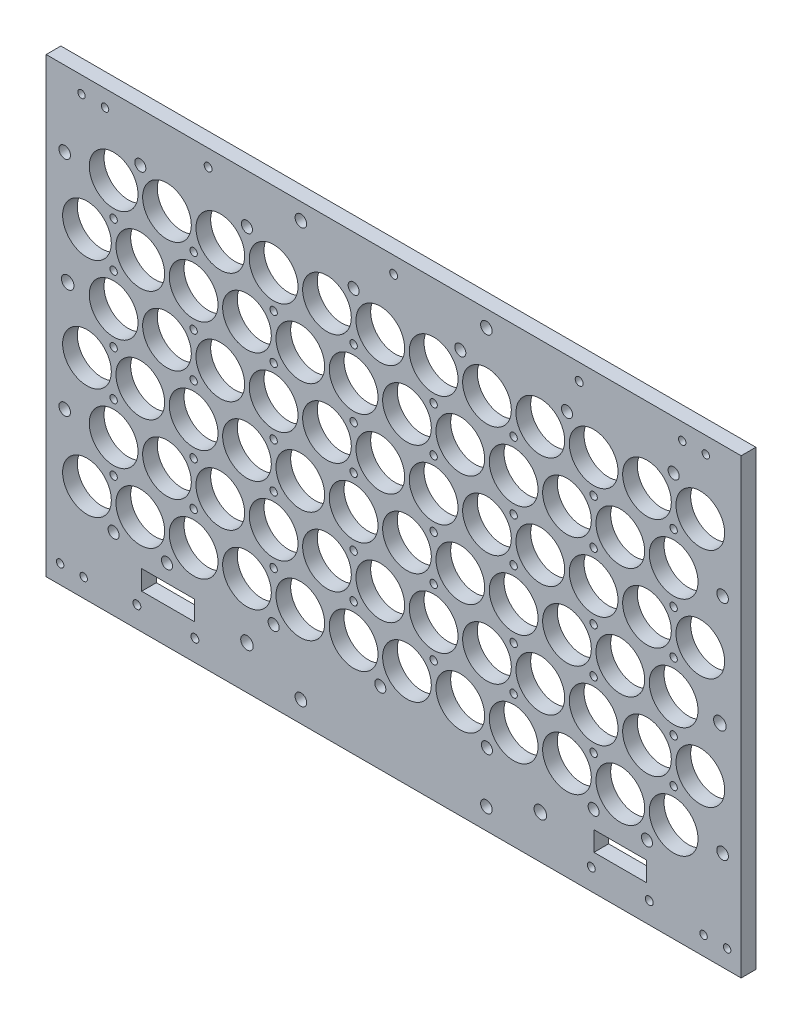
from build123d import *

# Parameters (mm, degrees)
SKETCH1_W                  = 299.700000132
SKETCH1_H                  = 194.250000104
BOSS_EXTRUDE1_DEPTH        = 6.35
SKETCH3_R                  = 10.4988
CUT_EXTRUDE1_DEPTH         = 182.719853184
SKETCH4_R                  = 10.4988
CUT_EXTRUDE2_DEPTH         = 182.719853184
LPATTERN1_COUNT            = 12
LPATTERN1_PITCH            = 23
LPATTERN2_COPY_1_SKETCH_R  = 10.4988
LPATTERN2_COPY_1_DEPTH     = 182.719853184
LPATTERN2_COPY_2_SKETCH_R  = 10.4988
LPATTERN2_COPY_2_DEPTH     = 182.719853184
LPATTERN2_COPY_3_SKETCH_R  = 10.4988
LPATTERN2_COPY_3_DEPTH     = 182.719853184
LPATTERN2_COPY_4_SKETCH_R  = 10.4988
LPATTERN2_COPY_4_DEPTH     = 182.719853184
LPATTERN2_COPY_5_SKETCH_R  = 10.4988
LPATTERN2_COPY_5_DEPTH     = 182.719853184
LPATTERN2_COPY_6_SKETCH_R  = 10.4988
LPATTERN2_COPY_6_DEPTH     = 182.719853184
LPATTERN2_COPY_7_SKETCH_R  = 10.4988
LPATTERN2_COPY_7_DEPTH     = 182.719853184
LPATTERN2_COPY_8_SKETCH_R  = 10.4988
LPATTERN2_COPY_8_DEPTH     = 182.719853184
LPATTERN2_COPY_9_SKETCH_R  = 10.4988
LPATTERN2_COPY_9_DEPTH     = 182.719853184
LPATTERN2_COPY_10_SKETCH_R = 10.4988
LPATTERN2_COPY_10_DEPTH    = 182.719853184
LPATTERN2_COPY_11_SKETCH_R = 10.4988
LPATTERN2_COPY_11_DEPTH    = 182.719853184
LPATTERN2_COPY_12_SKETCH_R = 10.4988
LPATTERN2_COPY_12_DEPTH    = 182.719853184
LPATTERN2_COPY_13_SKETCH_R = 10.4988
LPATTERN2_COPY_13_DEPTH    = 182.719853184
LPATTERN2_COPY_14_SKETCH_R = 10.4988
LPATTERN2_COPY_14_DEPTH    = 182.719853184
LPATTERN2_COPY_15_SKETCH_R = 10.4988
LPATTERN2_COPY_15_DEPTH    = 182.719853184
LPATTERN2_COPY_16_SKETCH_R = 10.4988
LPATTERN2_COPY_16_DEPTH    = 182.719853184
LPATTERN2_COPY_17_SKETCH_R = 10.4988
LPATTERN2_COPY_17_DEPTH    = 182.719853184
LPATTERN2_COPY_18_SKETCH_R = 10.4988
LPATTERN2_COPY_18_DEPTH    = 182.719853184
LPATTERN2_COPY_19_SKETCH_R = 10.4988
LPATTERN2_COPY_19_DEPTH    = 182.719853184
LPATTERN2_COPY_20_SKETCH_R = 10.4988
LPATTERN2_COPY_20_DEPTH    = 182.719853184
LPATTERN2_COPY_21_SKETCH_R = 10.4988
LPATTERN2_COPY_21_DEPTH    = 182.719853184
LPATTERN2_COPY_22_SKETCH_R = 10.4988
LPATTERN2_COPY_22_DEPTH    = 182.719853184
LPATTERN2_COPY_23_SKETCH_R = 10.4988
LPATTERN2_COPY_23_DEPTH    = 182.719853184
LPATTERN2_COPY_24_SKETCH_R = 10.4988
LPATTERN2_COPY_24_DEPTH    = 182.719853184
LPATTERN2_COPY_25_SKETCH_R = 10.4988
LPATTERN2_COPY_25_DEPTH    = 182.719853184
LPATTERN2_COPY_26_SKETCH_R = 10.4988
LPATTERN2_COPY_26_DEPTH    = 182.719853184
LPATTERN2_COPY_27_SKETCH_R = 10.4988
LPATTERN2_COPY_27_DEPTH    = 182.719853184
LPATTERN2_COPY_28_SKETCH_R = 10.4988
LPATTERN2_COPY_28_DEPTH    = 182.719853184
LPATTERN2_COPY_29_SKETCH_R = 10.4988
LPATTERN2_COPY_29_DEPTH    = 182.719853184
LPATTERN2_COPY_30_SKETCH_R = 10.4988
LPATTERN2_COPY_30_DEPTH    = 182.719853184
LPATTERN2_COPY_31_SKETCH_R = 10.4988
LPATTERN2_COPY_31_DEPTH    = 182.719853184
LPATTERN2_COPY_32_SKETCH_R = 10.4988
LPATTERN2_COPY_32_DEPTH    = 182.719853184
LPATTERN2_COPY_33_SKETCH_R = 10.4988
LPATTERN2_COPY_33_DEPTH    = 182.719853184
LPATTERN2_COPY_34_SKETCH_R = 10.4988
LPATTERN2_COPY_34_DEPTH    = 182.719853184
LPATTERN2_COPY_35_SKETCH_R = 10.4988
LPATTERN2_COPY_35_DEPTH    = 182.719853184
LPATTERN2_COPY_36_SKETCH_R = 10.4988
LPATTERN2_COPY_36_DEPTH    = 182.719853184
LPATTERN2_COPY_37_SKETCH_R = 10.4988
LPATTERN2_COPY_37_DEPTH    = 182.719853184
LPATTERN2_COPY_38_SKETCH_R = 10.4988
LPATTERN2_COPY_38_DEPTH    = 182.719853184
LPATTERN2_COPY_39_SKETCH_R = 10.4988
LPATTERN2_COPY_39_DEPTH    = 182.719853184
LPATTERN2_COPY_40_SKETCH_R = 10.4988
LPATTERN2_COPY_40_DEPTH    = 182.719853184
LPATTERN2_COPY_41_SKETCH_R = 10.4988
LPATTERN2_COPY_41_DEPTH    = 182.719853184
LPATTERN2_COPY_42_SKETCH_R = 10.4988
LPATTERN2_COPY_42_DEPTH    = 182.719853184
LPATTERN2_COPY_43_SKETCH_R = 10.4988
LPATTERN2_COPY_43_DEPTH    = 182.719853184
LPATTERN2_COPY_44_SKETCH_R = 10.4988
LPATTERN2_COPY_44_DEPTH    = 182.719853184
LPATTERN2_COPY_45_SKETCH_R = 10.4988
LPATTERN2_COPY_45_DEPTH    = 182.719853184
LPATTERN2_COPY_46_SKETCH_R = 10.4988
LPATTERN2_COPY_46_DEPTH    = 182.719853184
LPATTERN2_COPY_47_SKETCH_R = 10.4988
LPATTERN2_COPY_47_DEPTH    = 182.719853184
LPATTERN2_COPY_48_SKETCH_R = 10.4988
LPATTERN2_COPY_48_DEPTH    = 182.719853184
SKETCH5_W                  = 22.76
SKETCH5_H                  = 8.4615
CUT_EXTRUDE3_DEPTH         = 182.719853184
M3_CLEARANCE_HOLE1_D       = 3.2
M3_CLEARANCE_HOLE2_D       = 3.4
SKETCH14_R                 = 2.7
CUT_EXTRUDE4_DEPTH         = 182.719853184
SKETCH15_R                 = 2.5
CUT_EXTRUDE5_DEPTH         = 182.719853184
SKETCH18_R                 = 2.38125
CUT_EXTRUDE7_DEPTH         = 182.719853184
SKETCH19_W                 = 299.700000132
SKETCH19_H                 = 6.35
BOSS_EXTRUDE2_DEPTH        = 0.79375
SKETCH22_R                 = 1.5875
CUT_EXTRUDE8_DEPTH         = 182.719853184
LPATTERN3_COUNT            = 3
LPATTERN3_PITCH            = 48
SKETCH23_R                 = 1.5875
CUT_EXTRUDE9_DEPTH         = 182.719853184
LPATTERN4_COUNT            = 2
LPATTERN4_PITCH            = 48
LPATTERN5_COUNT            = 4
LPATTERN5_PITCH            = 69
LPATTERN5_COPY_1_SKETCH_R  = 1.5875
LPATTERN5_COPY_1_DEPTH     = 182.719853184
LPATTERN5_COPY_2_SKETCH_R  = 1.5875
LPATTERN5_COPY_2_DEPTH     = 182.719853184
LPATTERN5_COPY_3_SKETCH_R  = 1.5875
LPATTERN5_COPY_3_DEPTH     = 182.719853184
LPATTERN5_COPY_4_SKETCH_R  = 1.5875
LPATTERN5_COPY_4_DEPTH     = 182.719853184
LPATTERN5_COPY_5_SKETCH_R  = 1.5875
LPATTERN5_COPY_5_DEPTH     = 182.719853184
LPATTERN5_COPY_6_SKETCH_R  = 1.5875
LPATTERN5_COPY_6_DEPTH     = 182.719853184
LPATTERN5_COPY_7_SKETCH_R  = 1.5875
LPATTERN5_COPY_7_DEPTH     = 182.719853184
LPATTERN5_COPY_8_SKETCH_R  = 1.5875
LPATTERN5_COPY_8_DEPTH     = 182.719853184
LPATTERN5_COPY_9_SKETCH_R  = 1.5875
LPATTERN5_COPY_9_DEPTH     = 182.719853184
M3_CLEARANCE_HOLE3_D       = 3.4


with BuildPart() as part:
    # Sketch1 → Boss-Extrude1 (new body)
    with BuildSketch(Plane.XY):
        with Locations((0, -5.475000052)):
            Rectangle(SKETCH1_W, SKETCH1_H)
    extrude(amount=BOSS_EXTRUDE1_DEPTH)

    # Sketch3 → Cut-Extrude1 (cut, through all)
    with BuildSketch(Plane.XY.offset(6.35)):
        with Locations((-132.25, -60)):
            Circle(SKETCH3_R)
    cut_extrude1 = extrude(amount=-CUT_EXTRUDE1_DEPTH, mode=Mode.SUBTRACT)

    # Sketch4 → Cut-Extrude2 (cut, through all)
    with BuildSketch(Plane.XY.offset(6.35)):
        with Locations((-120.75, -36)):
            Circle(SKETCH4_R)
    cut_extrude2 = extrude(amount=-CUT_EXTRUDE2_DEPTH, mode=Mode.SUBTRACT)

    # LPattern1: Cut-Extrude1, Cut-Extrude2 ×12
    with Locations(*[(i * LPATTERN1_PITCH, 0, 0) for i in range(1, LPATTERN1_COUNT)]):
        add(cut_extrude1, mode=Mode.SUBTRACT)
        add(cut_extrude2, mode=Mode.SUBTRACT)

    # LPattern2 copy 1 sketch → LPattern2 copy 1 (cut, through all)
    with BuildSketch(Plane(origin=(23, 48, 6.35), x_dir=(1, 0, 0), z_dir=(0, 0, 1))):
        with Locations((-132.25, -60)):
            Circle(LPATTERN2_COPY_1_SKETCH_R)
    extrude(amount=-LPATTERN2_COPY_1_DEPTH, mode=Mode.SUBTRACT)

    # LPattern2 copy 2 sketch → LPattern2 copy 2 (cut, through all)
    with BuildSketch(Plane(origin=(23, 96, 6.35), x_dir=(1, 0, 0), z_dir=(0, 0, 1))):
        with Locations((-132.25, -60)):
            Circle(LPATTERN2_COPY_2_SKETCH_R)
    extrude(amount=-LPATTERN2_COPY_2_DEPTH, mode=Mode.SUBTRACT)

    # LPattern2 copy 3 sketch → LPattern2 copy 3 (cut, through all)
    with BuildSketch(Plane(origin=(46, 48, 6.35), x_dir=(1, 0, 0), z_dir=(0, 0, 1))):
        with Locations((-132.25, -60)):
            Circle(LPATTERN2_COPY_3_SKETCH_R)
    extrude(amount=-LPATTERN2_COPY_3_DEPTH, mode=Mode.SUBTRACT)

    # LPattern2 copy 4 sketch → LPattern2 copy 4 (cut, through all)
    with BuildSketch(Plane(origin=(46, 96, 6.35), x_dir=(1, 0, 0), z_dir=(0, 0, 1))):
        with Locations((-132.25, -60)):
            Circle(LPATTERN2_COPY_4_SKETCH_R)
    extrude(amount=-LPATTERN2_COPY_4_DEPTH, mode=Mode.SUBTRACT)

    # LPattern2 copy 5 sketch → LPattern2 copy 5 (cut, through all)
    with BuildSketch(Plane(origin=(69, 48, 6.35), x_dir=(1, 0, 0), z_dir=(0, 0, 1))):
        with Locations((-132.25, -60)):
            Circle(LPATTERN2_COPY_5_SKETCH_R)
    extrude(amount=-LPATTERN2_COPY_5_DEPTH, mode=Mode.SUBTRACT)

    # LPattern2 copy 6 sketch → LPattern2 copy 6 (cut, through all)
    with BuildSketch(Plane(origin=(69, 96, 6.35), x_dir=(1, 0, 0), z_dir=(0, 0, 1))):
        with Locations((-132.25, -60)):
            Circle(LPATTERN2_COPY_6_SKETCH_R)
    extrude(amount=-LPATTERN2_COPY_6_DEPTH, mode=Mode.SUBTRACT)

    # LPattern2 copy 7 sketch → LPattern2 copy 7 (cut, through all)
    with BuildSketch(Plane(origin=(92, 48, 6.35), x_dir=(1, 0, 0), z_dir=(0, 0, 1))):
        with Locations((-132.25, -60)):
            Circle(LPATTERN2_COPY_7_SKETCH_R)
    extrude(amount=-LPATTERN2_COPY_7_DEPTH, mode=Mode.SUBTRACT)

    # LPattern2 copy 8 sketch → LPattern2 copy 8 (cut, through all)
    with BuildSketch(Plane(origin=(92, 96, 6.35), x_dir=(1, 0, 0), z_dir=(0, 0, 1))):
        with Locations((-132.25, -60)):
            Circle(LPATTERN2_COPY_8_SKETCH_R)
    extrude(amount=-LPATTERN2_COPY_8_DEPTH, mode=Mode.SUBTRACT)

    # LPattern2 copy 9 sketch → LPattern2 copy 9 (cut, through all)
    with BuildSketch(Plane(origin=(115, 48, 6.35), x_dir=(1, 0, 0), z_dir=(0, 0, 1))):
        with Locations((-132.25, -60)):
            Circle(LPATTERN2_COPY_9_SKETCH_R)
    extrude(amount=-LPATTERN2_COPY_9_DEPTH, mode=Mode.SUBTRACT)

    # LPattern2 copy 10 sketch → LPattern2 copy 10 (cut, through all)
    with BuildSketch(Plane(origin=(115, 96, 6.35), x_dir=(1, 0, 0), z_dir=(0, 0, 1))):
        with Locations((-132.25, -60)):
            Circle(LPATTERN2_COPY_10_SKETCH_R)
    extrude(amount=-LPATTERN2_COPY_10_DEPTH, mode=Mode.SUBTRACT)

    # LPattern2 copy 11 sketch → LPattern2 copy 11 (cut, through all)
    with BuildSketch(Plane(origin=(138, 48, 6.35), x_dir=(1, 0, 0), z_dir=(0, 0, 1))):
        with Locations((-132.25, -60)):
            Circle(LPATTERN2_COPY_11_SKETCH_R)
    extrude(amount=-LPATTERN2_COPY_11_DEPTH, mode=Mode.SUBTRACT)

    # LPattern2 copy 12 sketch → LPattern2 copy 12 (cut, through all)
    with BuildSketch(Plane(origin=(138, 96, 6.35), x_dir=(1, 0, 0), z_dir=(0, 0, 1))):
        with Locations((-132.25, -60)):
            Circle(LPATTERN2_COPY_12_SKETCH_R)
    extrude(amount=-LPATTERN2_COPY_12_DEPTH, mode=Mode.SUBTRACT)

    # LPattern2 copy 13 sketch → LPattern2 copy 13 (cut, through all)
    with BuildSketch(Plane(origin=(161, 48, 6.35), x_dir=(1, 0, 0), z_dir=(0, 0, 1))):
        with Locations((-132.25, -60)):
            Circle(LPATTERN2_COPY_13_SKETCH_R)
    extrude(amount=-LPATTERN2_COPY_13_DEPTH, mode=Mode.SUBTRACT)

    # LPattern2 copy 14 sketch → LPattern2 copy 14 (cut, through all)
    with BuildSketch(Plane(origin=(161, 96, 6.35), x_dir=(1, 0, 0), z_dir=(0, 0, 1))):
        with Locations((-132.25, -60)):
            Circle(LPATTERN2_COPY_14_SKETCH_R)
    extrude(amount=-LPATTERN2_COPY_14_DEPTH, mode=Mode.SUBTRACT)

    # LPattern2 copy 15 sketch → LPattern2 copy 15 (cut, through all)
    with BuildSketch(Plane(origin=(184, 48, 6.35), x_dir=(1, 0, 0), z_dir=(0, 0, 1))):
        with Locations((-132.25, -60)):
            Circle(LPATTERN2_COPY_15_SKETCH_R)
    extrude(amount=-LPATTERN2_COPY_15_DEPTH, mode=Mode.SUBTRACT)

    # LPattern2 copy 16 sketch → LPattern2 copy 16 (cut, through all)
    with BuildSketch(Plane(origin=(184, 96, 6.35), x_dir=(1, 0, 0), z_dir=(0, 0, 1))):
        with Locations((-132.25, -60)):
            Circle(LPATTERN2_COPY_16_SKETCH_R)
    extrude(amount=-LPATTERN2_COPY_16_DEPTH, mode=Mode.SUBTRACT)

    # LPattern2 copy 17 sketch → LPattern2 copy 17 (cut, through all)
    with BuildSketch(Plane(origin=(207, 48, 6.35), x_dir=(1, 0, 0), z_dir=(0, 0, 1))):
        with Locations((-132.25, -60)):
            Circle(LPATTERN2_COPY_17_SKETCH_R)
    extrude(amount=-LPATTERN2_COPY_17_DEPTH, mode=Mode.SUBTRACT)

    # LPattern2 copy 18 sketch → LPattern2 copy 18 (cut, through all)
    with BuildSketch(Plane(origin=(207, 96, 6.35), x_dir=(1, 0, 0), z_dir=(0, 0, 1))):
        with Locations((-132.25, -60)):
            Circle(LPATTERN2_COPY_18_SKETCH_R)
    extrude(amount=-LPATTERN2_COPY_18_DEPTH, mode=Mode.SUBTRACT)

    # LPattern2 copy 19 sketch → LPattern2 copy 19 (cut, through all)
    with BuildSketch(Plane(origin=(230, 48, 6.35), x_dir=(1, 0, 0), z_dir=(0, 0, 1))):
        with Locations((-132.25, -60)):
            Circle(LPATTERN2_COPY_19_SKETCH_R)
    extrude(amount=-LPATTERN2_COPY_19_DEPTH, mode=Mode.SUBTRACT)

    # LPattern2 copy 20 sketch → LPattern2 copy 20 (cut, through all)
    with BuildSketch(Plane(origin=(230, 96, 6.35), x_dir=(1, 0, 0), z_dir=(0, 0, 1))):
        with Locations((-132.25, -60)):
            Circle(LPATTERN2_COPY_20_SKETCH_R)
    extrude(amount=-LPATTERN2_COPY_20_DEPTH, mode=Mode.SUBTRACT)

    # LPattern2 copy 21 sketch → LPattern2 copy 21 (cut, through all)
    with BuildSketch(Plane(origin=(253, 48, 6.35), x_dir=(1, 0, 0), z_dir=(0, 0, 1))):
        with Locations((-132.25, -60)):
            Circle(LPATTERN2_COPY_21_SKETCH_R)
    extrude(amount=-LPATTERN2_COPY_21_DEPTH, mode=Mode.SUBTRACT)

    # LPattern2 copy 22 sketch → LPattern2 copy 22 (cut, through all)
    with BuildSketch(Plane(origin=(253, 96, 6.35), x_dir=(1, 0, 0), z_dir=(0, 0, 1))):
        with Locations((-132.25, -60)):
            Circle(LPATTERN2_COPY_22_SKETCH_R)
    extrude(amount=-LPATTERN2_COPY_22_DEPTH, mode=Mode.SUBTRACT)

    # LPattern2 copy 23 sketch → LPattern2 copy 23 (cut, through all)
    with BuildSketch(Plane(origin=(23, 48, 6.35), x_dir=(1, 0, 0), z_dir=(0, 0, 1))):
        with Locations((-120.75, -36)):
            Circle(LPATTERN2_COPY_23_SKETCH_R)
    extrude(amount=-LPATTERN2_COPY_23_DEPTH, mode=Mode.SUBTRACT)

    # LPattern2 copy 24 sketch → LPattern2 copy 24 (cut, through all)
    with BuildSketch(Plane(origin=(23, 96, 6.35), x_dir=(1, 0, 0), z_dir=(0, 0, 1))):
        with Locations((-120.75, -36)):
            Circle(LPATTERN2_COPY_24_SKETCH_R)
    extrude(amount=-LPATTERN2_COPY_24_DEPTH, mode=Mode.SUBTRACT)

    # LPattern2 copy 25 sketch → LPattern2 copy 25 (cut, through all)
    with BuildSketch(Plane(origin=(46, 48, 6.35), x_dir=(1, 0, 0), z_dir=(0, 0, 1))):
        with Locations((-120.75, -36)):
            Circle(LPATTERN2_COPY_25_SKETCH_R)
    extrude(amount=-LPATTERN2_COPY_25_DEPTH, mode=Mode.SUBTRACT)

    # LPattern2 copy 26 sketch → LPattern2 copy 26 (cut, through all)
    with BuildSketch(Plane(origin=(46, 96, 6.35), x_dir=(1, 0, 0), z_dir=(0, 0, 1))):
        with Locations((-120.75, -36)):
            Circle(LPATTERN2_COPY_26_SKETCH_R)
    extrude(amount=-LPATTERN2_COPY_26_DEPTH, mode=Mode.SUBTRACT)

    # LPattern2 copy 27 sketch → LPattern2 copy 27 (cut, through all)
    with BuildSketch(Plane(origin=(69, 48, 6.35), x_dir=(1, 0, 0), z_dir=(0, 0, 1))):
        with Locations((-120.75, -36)):
            Circle(LPATTERN2_COPY_27_SKETCH_R)
    extrude(amount=-LPATTERN2_COPY_27_DEPTH, mode=Mode.SUBTRACT)

    # LPattern2 copy 28 sketch → LPattern2 copy 28 (cut, through all)
    with BuildSketch(Plane(origin=(69, 96, 6.35), x_dir=(1, 0, 0), z_dir=(0, 0, 1))):
        with Locations((-120.75, -36)):
            Circle(LPATTERN2_COPY_28_SKETCH_R)
    extrude(amount=-LPATTERN2_COPY_28_DEPTH, mode=Mode.SUBTRACT)

    # LPattern2 copy 29 sketch → LPattern2 copy 29 (cut, through all)
    with BuildSketch(Plane(origin=(92, 48, 6.35), x_dir=(1, 0, 0), z_dir=(0, 0, 1))):
        with Locations((-120.75, -36)):
            Circle(LPATTERN2_COPY_29_SKETCH_R)
    extrude(amount=-LPATTERN2_COPY_29_DEPTH, mode=Mode.SUBTRACT)

    # LPattern2 copy 30 sketch → LPattern2 copy 30 (cut, through all)
    with BuildSketch(Plane(origin=(92, 96, 6.35), x_dir=(1, 0, 0), z_dir=(0, 0, 1))):
        with Locations((-120.75, -36)):
            Circle(LPATTERN2_COPY_30_SKETCH_R)
    extrude(amount=-LPATTERN2_COPY_30_DEPTH, mode=Mode.SUBTRACT)

    # LPattern2 copy 31 sketch → LPattern2 copy 31 (cut, through all)
    with BuildSketch(Plane(origin=(115, 48, 6.35), x_dir=(1, 0, 0), z_dir=(0, 0, 1))):
        with Locations((-120.75, -36)):
            Circle(LPATTERN2_COPY_31_SKETCH_R)
    extrude(amount=-LPATTERN2_COPY_31_DEPTH, mode=Mode.SUBTRACT)

    # LPattern2 copy 32 sketch → LPattern2 copy 32 (cut, through all)
    with BuildSketch(Plane(origin=(115, 96, 6.35), x_dir=(1, 0, 0), z_dir=(0, 0, 1))):
        with Locations((-120.75, -36)):
            Circle(LPATTERN2_COPY_32_SKETCH_R)
    extrude(amount=-LPATTERN2_COPY_32_DEPTH, mode=Mode.SUBTRACT)

    # LPattern2 copy 33 sketch → LPattern2 copy 33 (cut, through all)
    with BuildSketch(Plane(origin=(138, 48, 6.35), x_dir=(1, 0, 0), z_dir=(0, 0, 1))):
        with Locations((-120.75, -36)):
            Circle(LPATTERN2_COPY_33_SKETCH_R)
    extrude(amount=-LPATTERN2_COPY_33_DEPTH, mode=Mode.SUBTRACT)

    # LPattern2 copy 34 sketch → LPattern2 copy 34 (cut, through all)
    with BuildSketch(Plane(origin=(138, 96, 6.35), x_dir=(1, 0, 0), z_dir=(0, 0, 1))):
        with Locations((-120.75, -36)):
            Circle(LPATTERN2_COPY_34_SKETCH_R)
    extrude(amount=-LPATTERN2_COPY_34_DEPTH, mode=Mode.SUBTRACT)

    # LPattern2 copy 35 sketch → LPattern2 copy 35 (cut, through all)
    with BuildSketch(Plane(origin=(161, 48, 6.35), x_dir=(1, 0, 0), z_dir=(0, 0, 1))):
        with Locations((-120.75, -36)):
            Circle(LPATTERN2_COPY_35_SKETCH_R)
    extrude(amount=-LPATTERN2_COPY_35_DEPTH, mode=Mode.SUBTRACT)

    # LPattern2 copy 36 sketch → LPattern2 copy 36 (cut, through all)
    with BuildSketch(Plane(origin=(161, 96, 6.35), x_dir=(1, 0, 0), z_dir=(0, 0, 1))):
        with Locations((-120.75, -36)):
            Circle(LPATTERN2_COPY_36_SKETCH_R)
    extrude(amount=-LPATTERN2_COPY_36_DEPTH, mode=Mode.SUBTRACT)

    # LPattern2 copy 37 sketch → LPattern2 copy 37 (cut, through all)
    with BuildSketch(Plane(origin=(184, 48, 6.35), x_dir=(1, 0, 0), z_dir=(0, 0, 1))):
        with Locations((-120.75, -36)):
            Circle(LPATTERN2_COPY_37_SKETCH_R)
    extrude(amount=-LPATTERN2_COPY_37_DEPTH, mode=Mode.SUBTRACT)

    # LPattern2 copy 38 sketch → LPattern2 copy 38 (cut, through all)
    with BuildSketch(Plane(origin=(184, 96, 6.35), x_dir=(1, 0, 0), z_dir=(0, 0, 1))):
        with Locations((-120.75, -36)):
            Circle(LPATTERN2_COPY_38_SKETCH_R)
    extrude(amount=-LPATTERN2_COPY_38_DEPTH, mode=Mode.SUBTRACT)

    # LPattern2 copy 39 sketch → LPattern2 copy 39 (cut, through all)
    with BuildSketch(Plane(origin=(207, 48, 6.35), x_dir=(1, 0, 0), z_dir=(0, 0, 1))):
        with Locations((-120.75, -36)):
            Circle(LPATTERN2_COPY_39_SKETCH_R)
    extrude(amount=-LPATTERN2_COPY_39_DEPTH, mode=Mode.SUBTRACT)

    # LPattern2 copy 40 sketch → LPattern2 copy 40 (cut, through all)
    with BuildSketch(Plane(origin=(207, 96, 6.35), x_dir=(1, 0, 0), z_dir=(0, 0, 1))):
        with Locations((-120.75, -36)):
            Circle(LPATTERN2_COPY_40_SKETCH_R)
    extrude(amount=-LPATTERN2_COPY_40_DEPTH, mode=Mode.SUBTRACT)

    # LPattern2 copy 41 sketch → LPattern2 copy 41 (cut, through all)
    with BuildSketch(Plane(origin=(230, 48, 6.35), x_dir=(1, 0, 0), z_dir=(0, 0, 1))):
        with Locations((-120.75, -36)):
            Circle(LPATTERN2_COPY_41_SKETCH_R)
    extrude(amount=-LPATTERN2_COPY_41_DEPTH, mode=Mode.SUBTRACT)

    # LPattern2 copy 42 sketch → LPattern2 copy 42 (cut, through all)
    with BuildSketch(Plane(origin=(230, 96, 6.35), x_dir=(1, 0, 0), z_dir=(0, 0, 1))):
        with Locations((-120.75, -36)):
            Circle(LPATTERN2_COPY_42_SKETCH_R)
    extrude(amount=-LPATTERN2_COPY_42_DEPTH, mode=Mode.SUBTRACT)

    # LPattern2 copy 43 sketch → LPattern2 copy 43 (cut, through all)
    with BuildSketch(Plane(origin=(253, 48, 6.35), x_dir=(1, 0, 0), z_dir=(0, 0, 1))):
        with Locations((-120.75, -36)):
            Circle(LPATTERN2_COPY_43_SKETCH_R)
    extrude(amount=-LPATTERN2_COPY_43_DEPTH, mode=Mode.SUBTRACT)

    # LPattern2 copy 44 sketch → LPattern2 copy 44 (cut, through all)
    with BuildSketch(Plane(origin=(253, 96, 6.35), x_dir=(1, 0, 0), z_dir=(0, 0, 1))):
        with Locations((-120.75, -36)):
            Circle(LPATTERN2_COPY_44_SKETCH_R)
    extrude(amount=-LPATTERN2_COPY_44_DEPTH, mode=Mode.SUBTRACT)

    # LPattern2 copy 45 sketch → LPattern2 copy 45 (cut, through all)
    with BuildSketch(Plane(origin=(0, 48, 6.35), x_dir=(1, 0, 0), z_dir=(0, 0, 1))):
        with Locations((-132.25, -60)):
            Circle(LPATTERN2_COPY_45_SKETCH_R)
    extrude(amount=-LPATTERN2_COPY_45_DEPTH, mode=Mode.SUBTRACT)

    # LPattern2 copy 46 sketch → LPattern2 copy 46 (cut, through all)
    with BuildSketch(Plane(origin=(0, 96, 6.35), x_dir=(1, 0, 0), z_dir=(0, 0, 1))):
        with Locations((-132.25, -60)):
            Circle(LPATTERN2_COPY_46_SKETCH_R)
    extrude(amount=-LPATTERN2_COPY_46_DEPTH, mode=Mode.SUBTRACT)

    # LPattern2 copy 47 sketch → LPattern2 copy 47 (cut, through all)
    with BuildSketch(Plane(origin=(0, 48, 6.35), x_dir=(1, 0, 0), z_dir=(0, 0, 1))):
        with Locations((-120.75, -36)):
            Circle(LPATTERN2_COPY_47_SKETCH_R)
    extrude(amount=-LPATTERN2_COPY_47_DEPTH, mode=Mode.SUBTRACT)

    # LPattern2 copy 48 sketch → LPattern2 copy 48 (cut, through all)
    with BuildSketch(Plane(origin=(0, 96, 6.35), x_dir=(1, 0, 0), z_dir=(0, 0, 1))):
        with Locations((-120.75, -36)):
            Circle(LPATTERN2_COPY_48_SKETCH_R)
    extrude(amount=-LPATTERN2_COPY_48_DEPTH, mode=Mode.SUBTRACT)

    # Sketch5 → Cut-Extrude3 (cut, through all)
    with BuildSketch(Plane.XY.offset(6.35)):
        with Locations((97.75, -83.18075)):
            Rectangle(SKETCH5_W, SKETCH5_H)
        with Locations((-97.288, -83.18075)):
            Rectangle(SKETCH5_W, SKETCH5_H)
    extrude(amount=-CUT_EXTRUDE3_DEPTH, mode=Mode.SUBTRACT)

    # M3 Clearance Hole1 (through all)
    with Locations(Plane.XY.offset(6.35)):
        with Locations((124.450000066, 85.3), (134.610000066, 85.3), (-124.450000066, 85.3), (-134.610000066, 85.3), (-143.817500066, -94.6000001), (-133.657500066, -94.6000001), (133.657500066, -94.6000001), (143.817500066, -94.6000001)):
            Hole(M3_CLEARANCE_HOLE1_D / 2)

    # M3 Clearance Hole2 (through all)
    with Locations(Plane.XY.offset(6.35)):
        with Locations((110.25, -93.50575), (85.25, -93.50575), (-80, 85.3), (0, 85.3), (80, 85.3)):
            Hole(M3_CLEARANCE_HOLE2_D / 2)

    # Sketch14 → Cut-Extrude4 (cut, through all)
    with BuildSketch(Plane.XY.offset(6.35)):
        with Locations((140.687500033, -12)):
            Circle(SKETCH14_R)
        with Locations((-140.549400033, 12)):
            Circle(SKETCH14_R)
        with Locations((63.25, -83.95)):
            Circle(SKETCH14_R)
        with Locations((-63.25, -83.95)):
            Circle(SKETCH14_R)
    extrude(amount=-CUT_EXTRUDE4_DEPTH, mode=Mode.SUBTRACT)

    # Sketch15 → Cut-Extrude5 (cut, through all)
    with BuildSketch(Plane.XY.offset(6.35)):
        with Locations((-40, 85.3)):
            Circle(SKETCH15_R)
        with Locations((40, 85.3)):
            Circle(SKETCH15_R)
        with Locations((141.850000066, 36)):
            Circle(SKETCH15_R)
        with Locations((141.850000066, -60)):
            Circle(SKETCH15_R)
        with Locations((-141.850000066, -36)):
            Circle(SKETCH15_R)
        with Locations((-141.850000066, 60)):
            Circle(SKETCH15_R)
        with Locations((-40, -93.50575)):
            Circle(SKETCH15_R)
        with Locations((40, -93.50575)):
            Circle(SKETCH15_R)
    extrude(amount=-CUT_EXTRUDE5_DEPTH, mode=Mode.SUBTRACT)

    # Sketch18 → Cut-Extrude7 (cut, through all)
    with BuildSketch(Plane.XY.offset(6.35)):
        with Locations((109.25, -71.41)):
            Circle(SKETCH18_R)
        with Locations((86.25, -71.41)):
            Circle(SKETCH18_R)
        with Locations((120.75, 71.41)):
            Circle(SKETCH18_R)
        with Locations((74.75, 71.41)):
            Circle(SKETCH18_R)
        with Locations((28.75, 71.41)):
            Circle(SKETCH18_R)
        with Locations((-17.25, 71.41)):
            Circle(SKETCH18_R)
        with Locations((-63.25, 71.41)):
            Circle(SKETCH18_R)
        with Locations((-109.25, 71.41)):
            Circle(SKETCH18_R)
        with Locations((40.25, -71.41)):
            Circle(SKETCH18_R)
        with Locations((-5.75, -71.41)):
            Circle(SKETCH18_R)
        with Locations((-51.75, -71.41)):
            Circle(SKETCH18_R)
        with Locations((-97.75, -71.41)):
            Circle(SKETCH18_R)
        with Locations((-120.75, -71.41)):
            Circle(SKETCH18_R)
    extrude(amount=-CUT_EXTRUDE7_DEPTH, mode=Mode.SUBTRACT)

    # Sketch19 → Boss-Extrude2 (add)
    with BuildSketch(Plane(origin=(0, 91.65, 0), x_dir=(1, 0, 0), z_dir=(0, 1, 0))):
        with Locations((0, -3.175)):
            Rectangle(SKETCH19_W, SKETCH19_H)
    extrude(amount=BOSS_EXTRUDE2_DEPTH)

    # Sketch22 → Cut-Extrude8 (cut, through all)
    with BuildSketch(Plane.XY.offset(6.35)):
        with Locations((120.75, -45.467986122)):
            Circle(SKETCH22_R)
        with Locations((86.25, -50.28293229)):
            Circle(SKETCH22_R)
    cut_extrude8 = extrude(amount=-CUT_EXTRUDE8_DEPTH, mode=Mode.SUBTRACT)

    # LPattern3: Cut-Extrude8 ×3
    with Locations(*[(0, i * LPATTERN3_PITCH, 0) for i in range(1, LPATTERN3_COUNT)]):
        add(cut_extrude8, mode=Mode.SUBTRACT)

    # Sketch23 → Cut-Extrude9 (cut, through all)
    with BuildSketch(Plane.XY.offset(6.35)):
        with Locations((120.75, -26.532013878)):
            Circle(SKETCH23_R)
        with Locations((86.25, -21.71706771)):
            Circle(SKETCH23_R)
    cut_extrude9 = extrude(amount=-CUT_EXTRUDE9_DEPTH, mode=Mode.SUBTRACT)

    # LPattern4: Cut-Extrude9 ×2
    with Locations(*[(0, i * LPATTERN4_PITCH, 0) for i in range(1, LPATTERN4_COUNT)]):
        add(cut_extrude9, mode=Mode.SUBTRACT)

    # LPattern5: Cut-Extrude8, Cut-Extrude9 ×4
    with Locations(*[(-i * LPATTERN5_PITCH, 0, 0) for i in range(1, LPATTERN5_COUNT)]):
        add(cut_extrude8, mode=Mode.SUBTRACT)
        add(cut_extrude9, mode=Mode.SUBTRACT)

    # LPattern5 copy 1 sketch → LPattern5 copy 1 (cut, through all)
    with BuildSketch(Plane(origin=(-69, 48, 6.35), x_dir=(1, 0, 0), z_dir=(0, 0, 1))):
        with Locations((120.75, -45.467986122)):
            Circle(LPATTERN5_COPY_1_SKETCH_R)
        with Locations((86.25, -50.28293229)):
            Circle(LPATTERN5_COPY_1_SKETCH_R)
    extrude(amount=-LPATTERN5_COPY_1_DEPTH, mode=Mode.SUBTRACT)

    # LPattern5 copy 2 sketch → LPattern5 copy 2 (cut, through all)
    with BuildSketch(Plane(origin=(-138, 48, 6.35), x_dir=(1, 0, 0), z_dir=(0, 0, 1))):
        with Locations((120.75, -45.467986122)):
            Circle(LPATTERN5_COPY_2_SKETCH_R)
        with Locations((86.25, -50.28293229)):
            Circle(LPATTERN5_COPY_2_SKETCH_R)
    extrude(amount=-LPATTERN5_COPY_2_DEPTH, mode=Mode.SUBTRACT)

    # LPattern5 copy 3 sketch → LPattern5 copy 3 (cut, through all)
    with BuildSketch(Plane(origin=(-207, 48, 6.35), x_dir=(1, 0, 0), z_dir=(0, 0, 1))):
        with Locations((120.75, -45.467986122)):
            Circle(LPATTERN5_COPY_3_SKETCH_R)
        with Locations((86.25, -50.28293229)):
            Circle(LPATTERN5_COPY_3_SKETCH_R)
    extrude(amount=-LPATTERN5_COPY_3_DEPTH, mode=Mode.SUBTRACT)

    # LPattern5 copy 4 sketch → LPattern5 copy 4 (cut, through all)
    with BuildSketch(Plane(origin=(-69, 96, 6.35), x_dir=(1, 0, 0), z_dir=(0, 0, 1))):
        with Locations((120.75, -45.467986122)):
            Circle(LPATTERN5_COPY_4_SKETCH_R)
        with Locations((86.25, -50.28293229)):
            Circle(LPATTERN5_COPY_4_SKETCH_R)
    extrude(amount=-LPATTERN5_COPY_4_DEPTH, mode=Mode.SUBTRACT)

    # LPattern5 copy 5 sketch → LPattern5 copy 5 (cut, through all)
    with BuildSketch(Plane(origin=(-138, 96, 6.35), x_dir=(1, 0, 0), z_dir=(0, 0, 1))):
        with Locations((120.75, -45.467986122)):
            Circle(LPATTERN5_COPY_5_SKETCH_R)
        with Locations((86.25, -50.28293229)):
            Circle(LPATTERN5_COPY_5_SKETCH_R)
    extrude(amount=-LPATTERN5_COPY_5_DEPTH, mode=Mode.SUBTRACT)

    # LPattern5 copy 6 sketch → LPattern5 copy 6 (cut, through all)
    with BuildSketch(Plane(origin=(-207, 96, 6.35), x_dir=(1, 0, 0), z_dir=(0, 0, 1))):
        with Locations((120.75, -45.467986122)):
            Circle(LPATTERN5_COPY_6_SKETCH_R)
        with Locations((86.25, -50.28293229)):
            Circle(LPATTERN5_COPY_6_SKETCH_R)
    extrude(amount=-LPATTERN5_COPY_6_DEPTH, mode=Mode.SUBTRACT)

    # LPattern5 copy 7 sketch → LPattern5 copy 7 (cut, through all)
    with BuildSketch(Plane(origin=(-69, 48, 6.35), x_dir=(1, 0, 0), z_dir=(0, 0, 1))):
        with Locations((120.75, -26.532013878)):
            Circle(LPATTERN5_COPY_7_SKETCH_R)
        with Locations((86.25, -21.71706771)):
            Circle(LPATTERN5_COPY_7_SKETCH_R)
    extrude(amount=-LPATTERN5_COPY_7_DEPTH, mode=Mode.SUBTRACT)

    # LPattern5 copy 8 sketch → LPattern5 copy 8 (cut, through all)
    with BuildSketch(Plane(origin=(-138, 48, 6.35), x_dir=(1, 0, 0), z_dir=(0, 0, 1))):
        with Locations((120.75, -26.532013878)):
            Circle(LPATTERN5_COPY_8_SKETCH_R)
        with Locations((86.25, -21.71706771)):
            Circle(LPATTERN5_COPY_8_SKETCH_R)
    extrude(amount=-LPATTERN5_COPY_8_DEPTH, mode=Mode.SUBTRACT)

    # LPattern5 copy 9 sketch → LPattern5 copy 9 (cut, through all)
    with BuildSketch(Plane(origin=(-207, 48, 6.35), x_dir=(1, 0, 0), z_dir=(0, 0, 1))):
        with Locations((120.75, -26.532013878)):
            Circle(LPATTERN5_COPY_9_SKETCH_R)
        with Locations((86.25, -21.71706771)):
            Circle(LPATTERN5_COPY_9_SKETCH_R)
    extrude(amount=-LPATTERN5_COPY_9_DEPTH, mode=Mode.SUBTRACT)

    # M3 Clearance Hole3 (through all)
    with Locations(Plane.XY.offset(6.35)):
        with Locations((-85.712000066, -93.485979104), (-110.712000066, -93.485979104)):
            Hole(M3_CLEARANCE_HOLE3_D / 2)


solid = part.part
